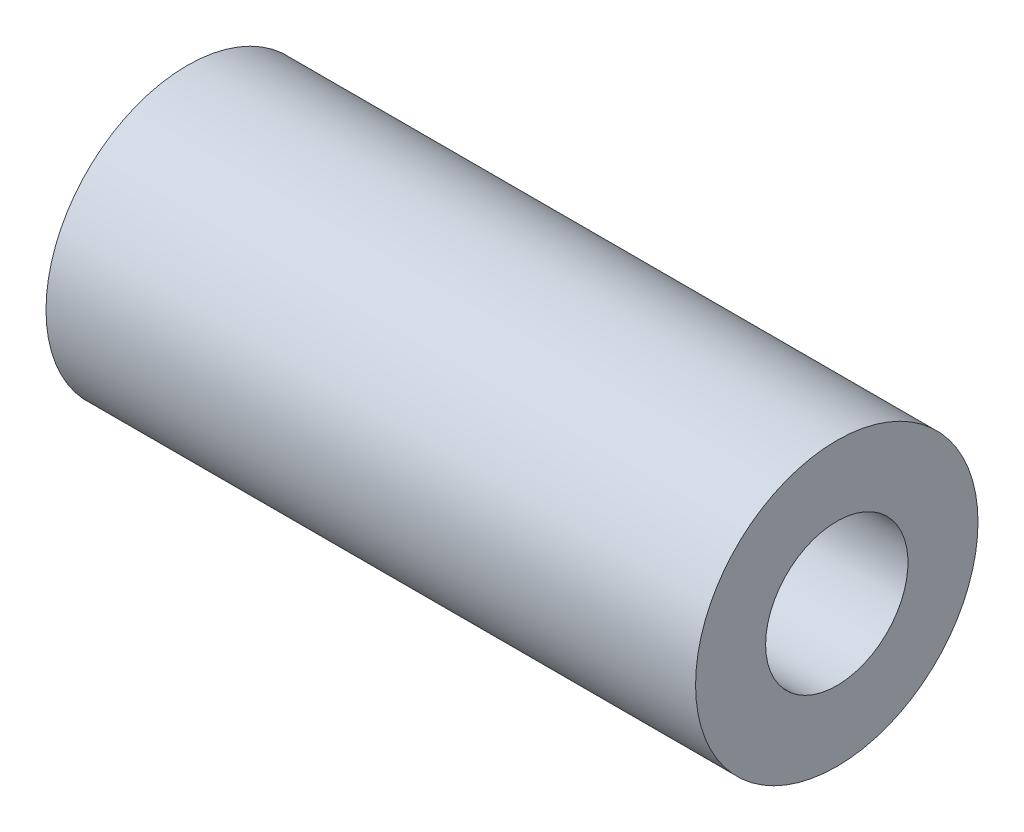
from build123d import *

# Parameters (mm, degrees)
SKETCH1_R           = 6.35
SKETCH1_R_2         = 3.2004
BOSS_EXTRUDE1_DEPTH = 29.21


with BuildPart() as part:
    # Sketch1 → Boss-Extrude1 (new body)
    with BuildSketch(Plane(origin=(0, 0, 0), x_dir=(0, 0, -1), z_dir=(1, 0, 0))):
        Circle(SKETCH1_R)
        Circle(SKETCH1_R_2, mode=Mode.SUBTRACT)
    extrude(amount=BOSS_EXTRUDE1_DEPTH)


solid = part.part
